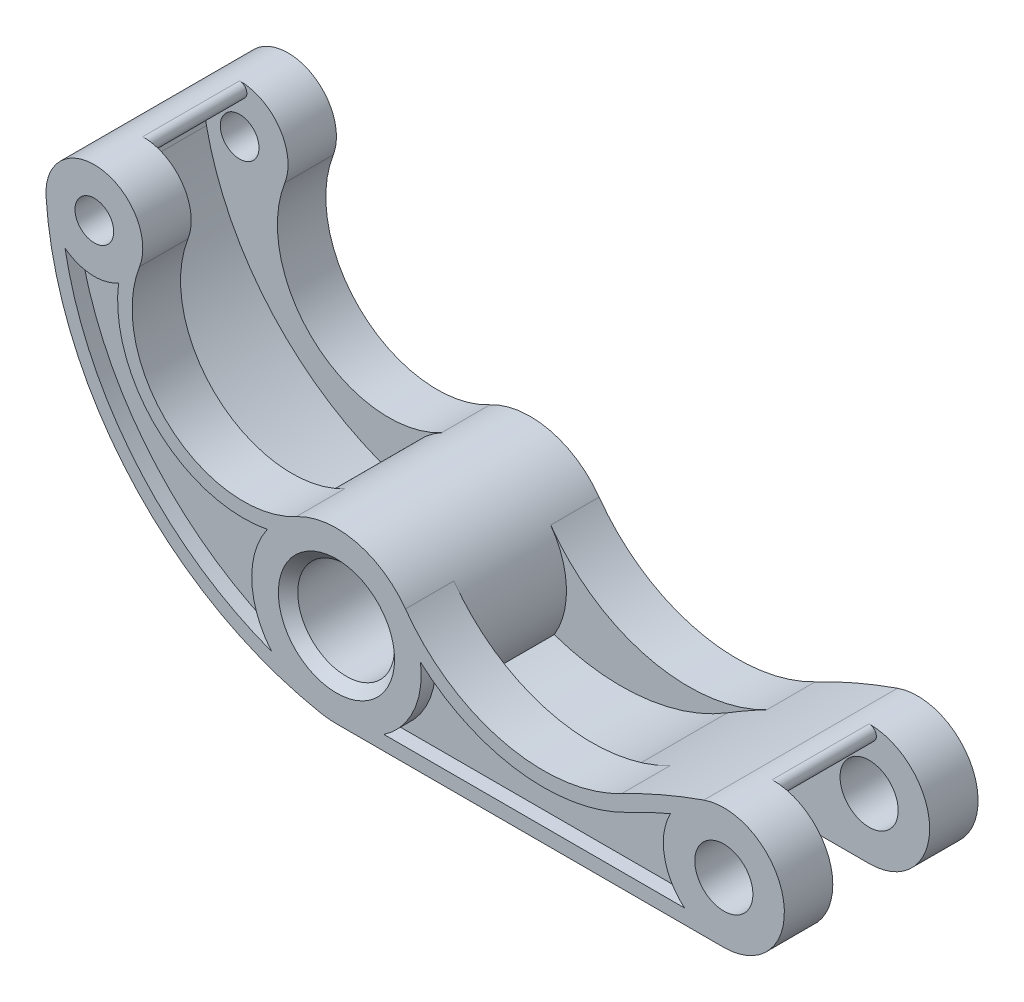
from build123d import *

# Parameters (mm, degrees)
SKETCH_1_R          = 17.5
SKETCH_1_R_2        = 10
EXTRUDE_1_DEPTH     = 20
EXTRUDE_START       = 20
EXTRUDE_3_DEPTH     = 10
SKETCH_1_5_R        = 10
SKETCH_1_5_R_2      = 4
SKETCH_1_5_R_3      = 12.5
SKETCH_1_5_R_4      = 6
EXTRUDE_6_DEPTH     = 10
EXTRUDE_START_2     = -20
EXTRUDE_5_DEPTH     = 10
CUT_EXTRUDE_2_DEPTH = 3
CHAMFER_2_SIZE      = 2


# Read off the part's stored shape, not the designer's step: 凸台-拉伸5
with BuildPart() as part:
    # 草图1 → 凸台-拉伸1 (new, symmetric)
    with BuildSketch(Plane.XY):
        Circle(SKETCH_1_R)
        Circle(SKETCH_1_R_2, mode=Mode.SUBTRACT)
    extrude(amount=EXTRUDE_1_DEPTH, both=True)

    # 草图1<4> → 凸台-拉伸3 (add)
    with BuildSketch(Plane.XY.offset(EXTRUDE_START)):
        with BuildLine():
            ThreePointArc((17.5, 0), (12.374368671, -12.374368671), (0, -17.5))
            Line((0, -17.5), (80, -17.5))
            ThreePointArc((80, -17.5), (67.677112384, -7.096769134), (75.865879936, 6.796569471))
            ThreePointArc((75.865879936, 6.796569471), (67.242154598, 3.424957178), (58.880298558, -0.551947613))
            ThreePointArc((58.880298558, -0.551947613), (34.559428753, -3.532537894), (14.243907079, 10.166666667))
            ThreePointArc((14.243907079, 10.166666667), (16.666108932, 5.33767862), (17.5, 0))
        make_face()
        with BuildLine():
            ThreePointArc((-59.977018957, 46.822436185), (-42.541382371, 5.155539161), (-3.287371248, -17.188460963))
            ThreePointArc((-3.287371248, -17.188460963), (-17.297108649, -2.657072143), (-8.294829009, 15.409276807))
            ThreePointArc((-8.294829009, 15.409276807), (-34.396147549, 18.399549118), (-40.66563766, 43.912566419))
            ThreePointArc((-40.66563766, 43.912566419), (-51.48999577, 37.611627404), (-59.977018957, 46.822436185))
        make_face()
    extrude_3 = extrude(amount=-EXTRUDE_3_DEPTH)

    # 草图1<5> → 凸台-拉伸6 (add)
    # profile 1 of 2: a face of its own
    with BuildSketch(Plane.XY.offset(EXTRUDE_START)):
        with Locations((-50, 47.5)):
            Circle(SKETCH_1_5_R)
        with Locations((-50, 47.5)):
            Circle(SKETCH_1_5_R_2, mode=Mode.SUBTRACT)
    # profile 2 of 2: a face of its own
    with BuildSketch(Plane.XY.offset(EXTRUDE_START)):
        with Locations((80, -5)):
            Circle(SKETCH_1_5_R_3)
        with Locations((80, -5)):
            Circle(SKETCH_1_5_R_4, mode=Mode.SUBTRACT)
    extrude_6 = extrude(amount=-EXTRUDE_6_DEPTH)

    # 凸台-拉伸5 outline → 凸台-拉伸5 (add)
    with BuildSketch(Plane.XY.offset(20).offset(EXTRUDE_START_2)):
        with BuildLine():
            ThreePointArc((75.865879936, 6.796569471), (62.989057462, 1.493490631), (50.753387878, -5.156591476))
            ThreePointArc((50.753387878, -5.156591476), (33.302431775, -11.134400774), (14.973225116, -9.058285137))
            ThreePointArc((14.973225116, -9.058285137), (14.103228764, -10.36093328), (13.120232239, -11.580565876))
            ThreePointArc((13.120232239, -11.580565876), (33.168505088, -14.164407302), (52.325095741, -7.711925974))
            ThreePointArc((52.325095741, -7.711925974), (64.278403719, -1.215307299), (76.858068751, 3.965392798))
            ThreePointArc((76.858068751, 3.965392798), (78.406455458, 4.365394588), (80, 4.5))
            ThreePointArc((80, 4.5), (81.5, 6), (80, 7.5))
            ThreePointArc((80, 7.5), (77.903230866, 7.322887616), (75.865879936, 6.796569471))
        make_face()
        with BuildLine():
            ThreePointArc((-59.785770553, 45.441190955), (-44.956168286, 16.668853496), (-17.493809847, -0.465421371))
            ThreePointArc((-17.493809847, -0.465421371), (-17.466783539, 1.077716469), (-17.303901028, 2.612471858))
            ThreePointArc((-17.303901028, 2.612471858), (-42.984788985, 18.9581848), (-56.850039387, 46.058833669))
            ThreePointArc((-56.850039387, 46.058833669), (-55.435446822, 51.910886287), (-50, 54.5))
            ThreePointArc((-50, 54.5), (-48.5, 56), (-50, 57.5))
            ThreePointArc((-50, 57.5), (-57.764924032, 53.801266125), (-59.785770553, 45.441190955))
        make_face()
    extrude_5 = extrude(amount=EXTRUDE_5_DEPTH)

    # 草图4 → 切除-拉伸2 (cut)
    with BuildSketch(Plane.XY.offset(20)):
        with BuildLine():
            Line((9.797958971, -14.5), (71.875961595, -14.5))
            ThreePointArc((71.875961595, -14.5), (67.71442663, -7.305360487), (68.984586296, 0.908524428))
            ThreePointArc((68.984586296, 0.908524428), (64.585377696, -1.069695724), (60.264462328, -3.213543123))
            ThreePointArc((60.264462328, -3.213543123), (37.965174398, -7.199867788), (17.359756877, 2.211072406))
            ThreePointArc((17.359756877, 2.211072406), (15.943662307, -7.214543107), (9.797958971, -14.5))
        make_face()
        with BuildLine():
            ThreePointArc((-14.267956002, 10.132888607), (-17.485179944, -0.720057157), (-13.386492598, -11.271726395))
            ThreePointArc((-13.386492598, -11.271726395), (-41.448404378, 8.481386673), (-56.049376429, 39.537271522))
            ThreePointArc((-56.049376429, 39.537271522), (-50.631027802, 37.519929664), (-45.001738128, 38.838742686))
            ThreePointArc((-45.001738128, 38.838742686), (-36.943813272, 16.660506762), (-14.267956002, 10.132888607))
        make_face()
    cut_extrude_2 = extrude(amount=-CUT_EXTRUDE_2_DEPTH, mode=Mode.SUBTRACT)

    # 倒角2
    chamfer_2_edges = [part.edges().sort_by_distance(p)[0] for p in [
        (-10, 0, 20),
    ]]
    chamfer(chamfer_2_edges, length=CHAMFER_2_SIZE)

    # 镜向6: 凸台-拉伸3, 凸台-拉伸6, 凸台-拉伸5, 切除-拉伸2 across plane
    add(extrude_3.mirror(Plane.XY))
    add(extrude_6.mirror(Plane.XY))
    add(extrude_5.mirror(Plane.XY))
    add(cut_extrude_2.mirror(Plane.XY), mode=Mode.SUBTRACT)


solid = part.part
